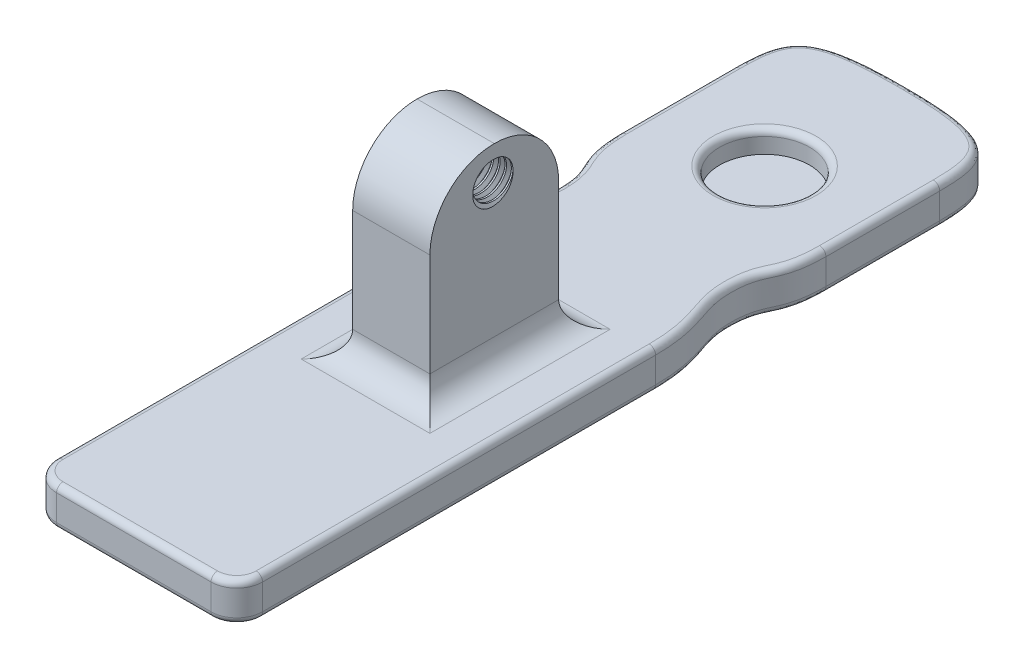
from build123d import *
from build123d.topology import SkipClean

# Parameters (mm, degrees)
SKETCH2_W           = 16
SKETCH2_H           = 60
BOSS_EXTRUDE1_DEPTH = 3
SKETCH3_W           = 6
SKETCH3_H           = 10
BOSS_EXTRUDE2_DEPTH = 15
SKETCH3_3_R         = 3.5
CUT_EXTRUDE1_DEPTH  = 1.7
FILLET2_R           = 2
SKETCH4_R           = 1.45
CUT_EXTRUDE2_DEPTH  = 38.877998
FILLET4_R           = 5
THREAD1_PITCH       = 0.5
CUT_EXTRUDE3_DEPTH  = 3
FILLET1_R           = 2
FILLET3_R           = 0.5


with BuildPart() as part:
    # Sketch2 → Boss-Extrude1 (new body)
    with BuildSketch(Plane(origin=(0, 0, 0), x_dir=(1, 0, 0), z_dir=(0, 1, 0))):
        with Locations((4.876106, -1.460177)):
            Rectangle(SKETCH2_W, SKETCH2_H)
    extrude(amount=BOSS_EXTRUDE1_DEPTH)

    # Sketch3 → Boss-Extrude2 (add)
    with BuildSketch(Plane(origin=(0, 3, 0), x_dir=(1, 0, 0), z_dir=(0, 1, 0))):
        with Locations((4.876106, -6.460177)):
            Rectangle(SKETCH3_W, SKETCH3_H)
    extrude(amount=BOSS_EXTRUDE2_DEPTH)

    # Sketch3<3> → Cut-Extrude1 (cut)
    with BuildSketch(Plane(origin=(0, 3, 0), x_dir=(1, 0, 0), z_dir=(0, 1, 0))):
        with Locations(Location((4.876106, 17.539823, 0), (0, 0, 270))):
            Circle(SKETCH3_3_R)
    extrude(amount=-CUT_EXTRUDE1_DEPTH, mode=Mode.SUBTRACT)

    # Fillet2
    fillet2_edges = [part.edges().sort_by_distance(p)[0] for p in [
        (1.876106, 3, 6.460177),
        (4.876106, 3, 11.460177),
        (4.876106, 3, 1.460177),
        (7.876106, 3, 6.460177),
    ]]
    fillet(fillet2_edges, radius=FILLET2_R)

    # Sketch4 → Cut-Extrude2 (cut, through all)
    with BuildSketch(Plane.ZY.offset(-1.876106)):
        with Locations((6.460177, 15.5)):
            Circle(SKETCH4_R)
    extrude(amount=-CUT_EXTRUDE2_DEPTH, mode=Mode.SUBTRACT)

    # Fillet4
    fillet4_edges = [part.edges().sort_by_distance(p)[0] for p in [
        (4.876106, 18, 1.460177),
        (4.876106, 18, 11.460177),
    ]]
    fillet(fillet4_edges, radius=FILLET4_R - 0.0001)  # a hair under: the kernel refuses the full size

    # Thread1: the profile of Thread Profile1 profile screwed along a right-hand helix of 12 turns, 6 arcs to a turn; built about Z, then put on its axis
    with SkipClean():  # the faces are left unmerged after this step: merging them gives an invalid solid
        thread1_z = Axis((0, 0, 0), (0, 0, 1))
        thread1_corners = [(1.4497, 0, -0.000173), (1.720633, 0, 0.15625), (1.720633, 0, 0.21875), (1.4497, 0, 0.375173)]
        with BuildLine(mode=Mode.PRIVATE) as thread1_profile:
            Line(thread1_corners[0], thread1_corners[1])
            Line(thread1_corners[1], thread1_corners[2])
            Line(thread1_corners[2], thread1_corners[3])
            Line(thread1_corners[3], thread1_corners[0])
        thread1_cap = Face(thread1_profile.wire())
        thread1_turn_angles = [0, 30, 60, 90, 120, 150, 180, 210, 240, 270, 300, 330, 360]
        thread1_turn_weights = [1, 0.8660254037844387, 1, 0.8660254037844387, 1, 0.8660254037844387, 1, 0.8660254037844387, 1, 0.8660254037844387, 1, 0.8660254037844387, 1]
        thread1_turn_rails = [Edge.make_bspline([Vector(p[0], p[1], 0).rotate(thread1_z, thread1_turn_angles[k]) / thread1_turn_weights[k] + Vector(0, 0, p[2] + THREAD1_PITCH * thread1_turn_angles[k] / 360) for k in range(13)], [0, 0, 0, 1, 1, 2, 2, 3, 3, 4, 4, 5, 5, 6, 6, 6], 2, thread1_turn_weights) for p in thread1_corners]
        thread1_turn_sides = [Face.make_surface_from_curves(thread1_turn_rails[p[0]], thread1_turn_rails[p[1]]) for p in [(0, 1), (1, 2), (2, 3), (3, 0)]]
        thread1 = Plane(origin=(1.876106, 15.5, 6.460177), x_dir=(0, 0, -1), z_dir=(1, 0, 0)) * Solid(Shell([*[p.moved(Location((0, 0, THREAD1_PITCH * i))) for i in range(12) for p in thread1_turn_sides], thread1_cap, thread1_cap.rotate(thread1_z, 4320).moved(Location((0, 0, THREAD1_PITCH * 4320 / 360)))]))
        add(thread1, mode=Mode.SUBTRACT)

    # Sketch7 → Cut-Extrude3 (cut)
    with SkipClean():  # the faces are left unmerged after this step: merging them gives an invalid solid
        with BuildSketch(Plane.XZ):
            with BuildLine():
                add(Edge.make_bspline(
                    [(4.625633, -28.539823), (-2.318347, -28.524629), (-3.105488, -27.226428), (-3.123894, -23.139348)],
                    knots=[0.011758, 0.011758, 0.011758, 0.011758, 1, 1, 1, 1], degree=3))
                Line((-3.123894, -23.139348), (-3.123894, -28.539823))
                Line((-3.123894, -28.539823), (4.625633, -28.539823))
            make_face()
            with BuildLine():
                Line((-3.123894, -1.072714), (-3.123894, -14.30514))
                add(Edge.make_bspline(
                    [(-3.123894, -1.072714), (-3.114884, -4.598627), (-1.7974, -5.875287), (-1.873136, -11.105136), (-3.089109, -10.879239), (-3.123894, -14.30514)],
                    knots=[0, 0, 0, 0, 0.399716, 0.499716, 1, 1, 1, 1], degree=3))
            make_face()
            with BuildLine():
                add(Edge.make_bspline(
                    [(12.876106, -1.072714), (12.867097, -4.598627), (11.549612, -5.875287), (11.625348, -11.105136), (12.841321, -10.879239), (12.876106, -14.30514)],
                    knots=[0, 0, 0, 0, 0.399716, 0.499716, 1, 1, 1, 1], degree=3))
                Line((12.876106, -14.30514), (12.876106, -1.072714))
            make_face()
            with BuildLine():
                add(Edge.make_bspline(
                    [(5.126579, -28.539823), (12.070559, -28.524629), (12.8577, -27.226428), (12.876106, -23.139348)],
                    knots=[0.011758, 0.011758, 0.011758, 0.011758, 1, 1, 1, 1], degree=3))
                Line((5.126579, -28.539823), (12.876106, -28.539823))
                Line((12.876106, -28.539823), (12.876106, -23.139348))
            make_face()
        extrude(amount=-CUT_EXTRUDE3_DEPTH, mode=Mode.SUBTRACT)

    # Fillet1
    fillet1_edges = [part.edges().sort_by_distance(p)[0] for p in [
        (12.876106, 1.5, 31.460177),
        (-3.123894, 1.5, 31.460177),
    ]]
    fillet(fillet1_edges, radius=FILLET1_R)

    # Fillet3
    fillet3_edges = [part.edges().sort_by_distance(p)[0] for p in [
        (-0.93404, 3, -27.878082),
        (4.876106, 0, 31.460177),
        (4.876106, 3, 31.460177),
        (12.876106, 0, 14.193731),
        (12.29032, 0, 30.874391),
        (-2.538107, 0, 30.874391),
        (12.876106, 3, 14.193731),
        (12.29032, 3, 30.874391),
        (-2.538107, 3, 30.874391),
        (4.876106, 3, -21.039823),
        (-3.123894, 0, -18.722244),
        (-3.123894, 0, 14.193731),
        (4.876106, 0, -28.539823),
        (12.876106, 0, -18.722244),
        (-0.93404, 0, -27.878082),
        (10.686253, 0, -27.878082),
        (4.876106, 3, -28.539823),
        (12.876106, 3, -18.722244),
        (-3.123894, 3, -18.722244),
        (-3.123894, 3, 14.193731),
        (10.686253, 3, -27.878082),
        (11.609268, 0, -7.708993),
        (11.609268, 3, -7.708993),
        (-1.857056, 3, -7.708993),
        (-1.857056, 0, -7.708993),
    ]]
    fillet(fillet3_edges, radius=FILLET3_R)


solid = part.part
